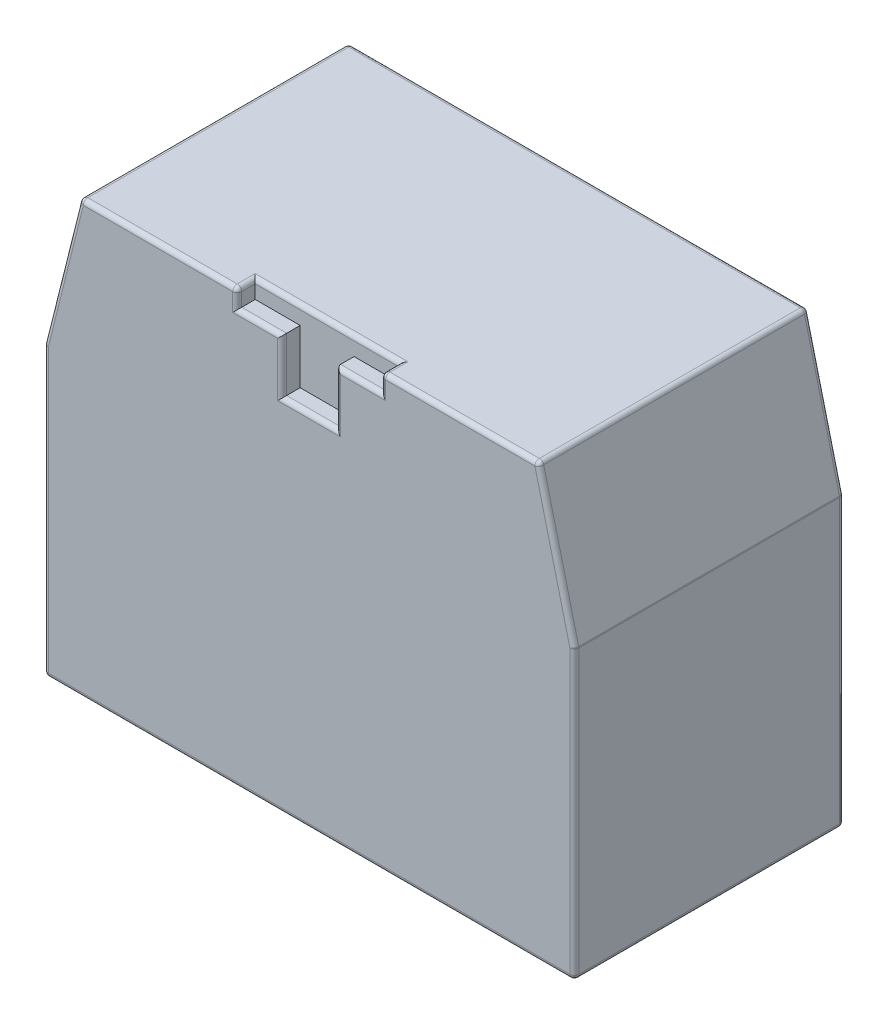
from build123d import *

# Parameters (mm, degrees)
BOSS_EXTRU_1_DEPTH      = 15
ENL_V_MAT_EXTRU_1_DEPTH = 1
ESQUISSE3_R             = 2.5
ENL_V_MAT_EXTRU_2_DEPTH = 2
CONG_1_R                = 0.25


with BuildPart() as part:
    # Esquisse1 → Boss.-Extru.1 (new body)
    with BuildSketch(Plane.XY):
        Polygon((0, 16), (2, 24), (27.5, 24), (29.5, 16), (29.5, 0), (0, 0), align=None)
    extrude(amount=BOSS_EXTRU_1_DEPTH)

    # Esquisse2 → Enlèv. mat.-Extru.1 (cut)
    with BuildSketch(Plane.XY.offset(15)):
        Polygon((16.25, 23), (18.75, 23), (18.75, 24), (10.75, 24), (10.75, 23), (13.25, 23), (13.25, 20), (16.25, 20), align=None)
    extrude(amount=-ENL_V_MAT_EXTRU_1_DEPTH, mode=Mode.SUBTRACT)

    # Esquisse3 → Enlèv. mat.-Extru.2 (cut)
    # profile 1 of 10: a face of its own
    with BuildSketch(Plane.XZ):
        with BuildLine():
            Line((8, 8), (8, 4))
            Line((8, 4), (2, 4))
            Line((2, 4), (2, 8))
            ThreePointArc((2, 8), (5, 11), (8, 8))
        make_face()
        with Locations(Location((5, 8, 0), (0, 0, 270))):
            Circle(ESQUISSE3_R, mode=Mode.SUBTRACT)
    # profile 2 of 10: a face of its own
    with BuildSketch(Plane.XZ):
        Polygon((5.451418397, 8.406224049), (6.574529481, 8.406224049), (6.574529481, 7.572948084), (5.451418397, 7.572948084), (5.451418397, 6.395492915), (4.654371821, 6.395492915), (4.654371821, 7.572948084), (3.404457873, 7.572948084), (3.404457873, 8.406224049), (4.654371821, 8.406224049), (4.654371821, 9.511220438), (5.451418397, 9.511220438), align=None)
    # profile 3 of 10: a face of its own
    with BuildSketch(Plane.XZ):
        with BuildLine():
            ThreePointArc((21.5, 8), (24.5, 11), (27.5, 8))
            Line((27.5, 8), (27.5, 4))
            Line((27.5, 4), (21.5, 4))
            Line((21.5, 4), (21.5, 8))
        make_face()
        with Locations(Location((24.5, 8, 0), (0, 0, 270))):
            Circle(ESQUISSE3_R, mode=Mode.SUBTRACT)
    # profile 4 of 10: a face of its own
    with BuildSketch(Plane.XZ):
        Polygon((24.048581603, 7.572948084), (22.925470519, 7.572948084), (22.925470519, 8.406224049), (24.048581603, 8.406224049), (24.048581603, 9.511220438), (24.845628179, 9.511220438), (24.845628179, 8.406224049), (26.095542127, 8.406224049), (26.095542127, 7.572948084), (24.845628179, 7.572948084), (24.845628179, 6.395492915), (24.048581603, 6.395492915), align=None)
    # profile 5 of 10: a face of its own
    with BuildSketch(Plane.XZ):
        with BuildLine():
            ThreePointArc((17.782508714, 11.769366031), (16.892304185, 13.902148971), (14.75, 14.76918989))
            Line((14.75, 14.76918989), (14.75, 14.269154659))
            ThreePointArc((14.75, 14.269154659), (16.538744492, 13.548589427), (17.282508714, 11.769366031))
            ThreePointArc((17.282508714, 11.769366031), (16.538744492, 9.990142635), (14.75, 9.269577403))
            Line((14.75, 9.269577403), (14.75, 8.769542172))
            ThreePointArc((14.75, 8.769542172), (16.892304185, 9.636583091), (17.782508714, 11.769366031))
        make_face()
    # profile 6 of 10: a face of its own
    with BuildSketch(Plane.XZ):
        with BuildLine():
            Line((14.75, 14.269154659), (14.75, 14.76918989))
            ThreePointArc((14.75, 14.76918989), (11.782508714, 11.769366031), (14.75, 8.769542172))
            Line((14.75, 8.769542172), (14.75, 9.269577403))
            ThreePointArc((14.75, 9.269577403), (12.282508714, 11.769366031), (14.75, 14.269154659))
        make_face()
    # profile 7 of 10: a face of its own
    with BuildSketch(Plane.XZ):
        with BuildLine():
            ThreePointArc((17.782508714, 11.769366031), (16.892304185, 13.902148971), (14.75, 14.76918989))
            Line((14.75, 14.76918989), (14.75, 14.269154659))
            ThreePointArc((14.75, 14.269154659), (16.538744492, 13.548589427), (17.282508714, 11.769366031))
            ThreePointArc((17.282508714, 11.769366031), (16.538744492, 9.990142635), (14.75, 9.269577403))
            Line((14.75, 9.269577403), (14.75, 8.769542172))
            ThreePointArc((14.75, 8.769542172), (16.892304185, 9.636583091), (17.782508714, 11.769366031))
        make_face()
    # profile 8 of 10: a face of its own
    with BuildSketch(Plane.XZ):
        with BuildLine():
            Line((14.75, 14.269154659), (14.75, 14.76918989))
            ThreePointArc((14.75, 14.76918989), (11.782508714, 11.769366031), (14.75, 8.769542172))
            Line((14.75, 8.769542172), (14.75, 9.269577403))
            ThreePointArc((14.75, 9.269577403), (12.282508714, 11.769366031), (14.75, 14.269154659))
        make_face()
    # profile 9 of 10: a face of its own
    with BuildSketch(Plane.XZ):
        Polygon((14.75, 10.164858946), (14.75, 13.280586469), (14.331090317, 13.280586469), (14.331090317, 12.17559008), (13.207979233, 12.17559008), (13.207979233, 11.342314115), (14.331090317, 11.342314115), (14.331090317, 10.164858946), align=None)
    # profile 10 of 10: a face of its own
    with BuildSketch(Plane.XZ):
        Polygon((15.128136892, 13.280586469), (14.75, 13.280586469), (14.75, 10.164858946), (15.128136892, 10.164858946), (15.128136892, 11.342314115), (16.378050841, 11.342314115), (16.378050841, 12.17559008), (15.128136892, 12.17559008), align=None)
    extrude(amount=-ENL_V_MAT_EXTRU_2_DEPTH, mode=Mode.SUBTRACT)

    # Congé1
    # the kernel refuses this fillet: 0.25 mm, written as the material it adds along each edge
    with BuildSketch(Plane(origin=(7.75, 1.75, 4.25), x_dir=(0, 1, 0), z_dir=(1, 0, 0))) as cong_1_piece_1_section:
        Polygon((0, 0), (CONG_1_R, 0), (CONG_1_R, -CONG_1_R), (0, -CONG_1_R), align=None)
    cong_1_piece_1 = extrude(amount=CONG_1_R, mode=Mode.PRIVATE)
    cong_1_piece_1 = cong_1_piece_1 - Plane(origin=(7.75, 1.75, 4.25), x_dir=(0, -0.7071067811865475, 0.7071067811865475), z_dir=(1, 0, 0)) * Sphere(CONG_1_R, mode=Mode.PRIVATE)
    add(cong_1_piece_1)
    with BuildSketch(Plane(origin=(2.25, 1.75, 4.25), x_dir=(-1, 0, 0), z_dir=(0, 1, 0))) as cong_1_piece_2_section:
        Polygon((0, 0), (CONG_1_R, 0), (CONG_1_R, -CONG_1_R), (0, -CONG_1_R), align=None)
    cong_1_piece_2 = extrude(amount=CONG_1_R, mode=Mode.PRIVATE)
    cong_1_piece_2 = cong_1_piece_2 - Plane(origin=(2.25, 1.75, 4.25), x_dir=(0.7071067811865475, 0, 0.7071067811865477), z_dir=(0, 1, 0)) * Sphere(CONG_1_R, mode=Mode.PRIVATE)
    add(cong_1_piece_2)
    with BuildSketch(Plane(origin=(27.25, 1.75, 4.25), x_dir=(0, 0, -1), z_dir=(0, 1, 0))) as cong_1_piece_3_section:
        Polygon((0, 0), (CONG_1_R, 0), (CONG_1_R, -CONG_1_R), (0, -CONG_1_R), align=None)
    cong_1_piece_3 = extrude(amount=CONG_1_R, mode=Mode.PRIVATE)
    cong_1_piece_3 = cong_1_piece_3 - Plane(origin=(27.25, 1.75, 4.25), x_dir=(-0.7071067811865475, 0, 0.7071067811865475), z_dir=(0, 1, 0)) * Sphere(CONG_1_R, mode=Mode.PRIVATE)
    add(cong_1_piece_3)
    with BuildSketch(Plane(origin=(21.75, 1.75, 4.25), x_dir=(0, 1, 0), z_dir=(-1, 0, 0))) as cong_1_piece_4_section:
        Polygon((0, 0), (CONG_1_R, 0), (CONG_1_R, CONG_1_R), (0, CONG_1_R), align=None)
    cong_1_piece_4 = extrude(amount=CONG_1_R, mode=Mode.PRIVATE)
    cong_1_piece_4 = cong_1_piece_4 - Plane(origin=(21.75, 1.75, 4.25), x_dir=(0, -0.7071067811865475, 0.7071067811865475), z_dir=(-1, 0, 0)) * Sphere(CONG_1_R, mode=Mode.PRIVATE)
    add(cong_1_piece_4)
    with BuildSketch(Plane(origin=(7.75, 2, 4), x_dir=(0, -1, 0), z_dir=(-1, 0, 0)), Plane(origin=(27.25, 2, 4), x_dir=(0, -1, 0), z_dir=(-1, 0, 0))) as cong_1_piece_5:
        with BuildLine():
            CenterArc((CONG_1_R, CONG_1_R), CONG_1_R, 180, 90)
            Line((0, CONG_1_R), (0, 0))
            Line((0, 0), (CONG_1_R, 0))
        make_face()
    extrude(amount=5.5)
    with BuildSketch(Plane(origin=(8, 0, 4), x_dir=(-1, 0, 0), z_dir=(0, 1, 0)), Plane(origin=(2, 0, 4), x_dir=(0, 0, 1), z_dir=(0, 1, 0)), Plane(origin=(27.5, 0, 4), x_dir=(-1, 0, 0), z_dir=(0, 1, 0)), Plane(origin=(21.5, 0, 4), x_dir=(0, 0, 1), z_dir=(0, 1, 0))) as cong_1_piece_6:
        with BuildLine():
            CenterArc((CONG_1_R, CONG_1_R), CONG_1_R, 180, 90)
            Line((0, CONG_1_R), (0, 0))
            Line((0, 0), (CONG_1_R, 0))
        make_face()
    extrude(amount=1.75)
    with BuildSketch(Plane(origin=(2, 2, 4.25), x_dir=(0, -1, 0), z_dir=(0, 0, 1)), Plane(origin=(8, 2, 8), x_dir=(0, -1, 0), z_dir=(0, 0, -1)), Plane(origin=(21.5, 2, 4.25), x_dir=(0, -1, 0), z_dir=(0, 0, 1)), Plane(origin=(27.5, 2, 8), x_dir=(0, -1, 0), z_dir=(0, 0, -1))) as cong_1_piece_7:
        with BuildLine():
            CenterArc((CONG_1_R, CONG_1_R), CONG_1_R, 180, 90)
            Line((0, CONG_1_R), (0, 0))
            Line((0, 0), (CONG_1_R, 0))
        make_face()
    extrude(amount=3.75)
    with BuildSketch(Plane(origin=(5, 2, 8), x_dir=(-1, 0, 0), z_dir=(0, 0, -1))) as cong_1_piece_8:
        with BuildLine():
            CenterArc((3 - CONG_1_R, -CONG_1_R), CONG_1_R, 0, 90)
            Line((3 - CONG_1_R, 0), (3, 0))
            Line((3, 0), (3, -CONG_1_R))
        make_face()
    revolve(axis=Axis((5, 2, 8), (0, 1, 0)), revolution_arc=180)
    with BuildSketch(Plane(origin=(24.5, 2, 8), x_dir=(-1, 0, 0), z_dir=(0, 0, -1))) as cong_1_piece_9:
        with BuildLine():
            CenterArc((3 - CONG_1_R, -CONG_1_R), CONG_1_R, 0, 90)
            Line((3 - CONG_1_R, 0), (3, 0))
            Line((3, 0), (3, -CONG_1_R))
        make_face()
    revolve(axis=Axis((24.5, 2, 8), (0, 1, 0)), revolution_arc=180)
    # the kernel refuses this fillet: 0.25 mm, written as the material it takes off along each edge
    with BuildSketch(Plane(origin=(29.25, 15.969223594, 14.75), x_dir=(0.9701425001453319, 0.2425356250363334, 0), z_dir=(0, 0, 1))) as cong_1_2_piece_1_section:
        Polygon((0, 0), (CONG_1_R, 0), (CONG_1_R, -CONG_1_R * 0.123105625618), (CONG_1_R * 0.970142500145, -CONG_1_R * 0.242535625036), align=None)
    cong_1_2_piece_1 = extrude(amount=CONG_1_R, mode=Mode.PRIVATE)
    cong_1_2_piece_1 = cong_1_2_piece_1 - Plane(origin=(29.25, 15.969223594, 14.75), x_dir=(-0.992507556682903, -0.12218326369570469, 0), z_dir=(0, 0, 1)) * Sphere(CONG_1_R, mode=Mode.PRIVATE)
    add(cong_1_2_piece_1, mode=Mode.SUBTRACT)
    with BuildSketch(Plane(origin=(29.25, 0.25, 14.75), x_dir=(0, 0, 1), z_dir=(1, 0, 0))) as cong_1_2_piece_2_section:
        Polygon((0, 0), (CONG_1_R, 0), (CONG_1_R, CONG_1_R), (0, CONG_1_R), align=None)
    cong_1_2_piece_2 = extrude(amount=CONG_1_R, mode=Mode.PRIVATE)
    cong_1_2_piece_2 = cong_1_2_piece_2 - Plane(origin=(29.25, 0.25, 14.75), x_dir=(0, 0.7071067811865475, -0.7071067811865475), z_dir=(1, 0, 0)) * Sphere(CONG_1_R, mode=Mode.PRIVATE)
    add(cong_1_2_piece_2, mode=Mode.SUBTRACT)
    with BuildSketch(Plane(origin=(0.25, 15.969223594, 0.25), x_dir=(-0.9701425001453319, 0.24253562503633297, 0), z_dir=(0, 0, -1))) as cong_1_2_piece_3_section:
        Polygon((0, 0), (CONG_1_R, 0), (CONG_1_R, -CONG_1_R * 0.123105625618), (CONG_1_R * 0.970142500145, -CONG_1_R * 0.242535625036), align=None)
    cong_1_2_piece_3 = extrude(amount=CONG_1_R, mode=Mode.PRIVATE)
    cong_1_2_piece_3 = cong_1_2_piece_3 - Plane(origin=(0.25, 15.969223594, 0.25), x_dir=(0.9925075566829031, -0.12218326369570448, 0), z_dir=(0, 0, -1)) * Sphere(CONG_1_R, mode=Mode.PRIVATE)
    add(cong_1_2_piece_3, mode=Mode.SUBTRACT)
    with BuildSketch(Plane(origin=(0.25, 15.969223594, 14.75), x_dir=(-0.9701425001453319, 0.24253562503633297, 0), z_dir=(0, 0, 1))) as cong_1_2_piece_4_section:
        Polygon((0, 0), (CONG_1_R, 0), (CONG_1_R, CONG_1_R * 0.123105625618), (CONG_1_R * 0.970142500145, CONG_1_R * 0.242535625036), align=None)
    cong_1_2_piece_4 = extrude(amount=CONG_1_R, mode=Mode.PRIVATE)
    cong_1_2_piece_4 = cong_1_2_piece_4 - Plane(origin=(0.25, 15.969223594, 14.75), x_dir=(0.9925075566829031, -0.12218326369570448, 0), z_dir=(0, 0, 1)) * Sphere(CONG_1_R, mode=Mode.PRIVATE)
    add(cong_1_2_piece_4, mode=Mode.SUBTRACT)
    with BuildSketch(Plane(origin=(2.195194102, 23.75, 0.25), x_dir=(-0.9701425001453319, 0.24253562503633297, 0), z_dir=(0, 0, -1))) as cong_1_2_piece_5_section:
        Polygon((0, 0), (CONG_1_R, 0), (CONG_1_R, CONG_1_R * 0.780776406404), (CONG_1_R * 0.242535625036, CONG_1_R * 0.970142500145), align=None)
    cong_1_2_piece_5 = extrude(amount=CONG_1_R, mode=Mode.PRIVATE)
    cong_1_2_piece_5 = cong_1_2_piece_5 - Plane(origin=(2.195194102, 23.75, 0.25), x_dir=(0.6154122094026356, -0.7882054380161092, 0), z_dir=(0, 0, -1)) * Sphere(CONG_1_R, mode=Mode.PRIVATE)
    add(cong_1_2_piece_5, mode=Mode.SUBTRACT)
    with BuildSketch(Plane(origin=(2.195194102, 23.75, 14.75), x_dir=(-0.9701425001453319, 0.24253562503633297, 0), z_dir=(0, 0, 1))) as cong_1_2_piece_6_section:
        Polygon((0, 0), (CONG_1_R, 0), (CONG_1_R, -CONG_1_R * 0.780776406404), (CONG_1_R * 0.242535625036, -CONG_1_R * 0.970142500145), align=None)
    cong_1_2_piece_6 = extrude(amount=CONG_1_R, mode=Mode.PRIVATE)
    cong_1_2_piece_6 = cong_1_2_piece_6 - Plane(origin=(2.195194102, 23.75, 14.75), x_dir=(0.6154122094026356, -0.7882054380161092, 0), z_dir=(0, 0, 1)) * Sphere(CONG_1_R, mode=Mode.PRIVATE)
    add(cong_1_2_piece_6, mode=Mode.SUBTRACT)
    with BuildSketch(Plane(origin=(27.304805898, 23.75, 0.25), x_dir=(0.9701425001453319, 0.2425356250363334, 0), z_dir=(0, 0, -1))) as cong_1_2_piece_7_section:
        Polygon((0, 0), (CONG_1_R, 0), (CONG_1_R, -CONG_1_R * 0.780776406404), (CONG_1_R * 0.242535625036, -CONG_1_R * 0.970142500145), align=None)
    cong_1_2_piece_7 = extrude(amount=CONG_1_R, mode=Mode.PRIVATE)
    cong_1_2_piece_7 = cong_1_2_piece_7 - Plane(origin=(27.304805898, 23.75, 0.25), x_dir=(-0.6154122094026354, -0.7882054380161092, 0), z_dir=(0, 0, -1)) * Sphere(CONG_1_R, mode=Mode.PRIVATE)
    add(cong_1_2_piece_7, mode=Mode.SUBTRACT)
    with BuildSketch(Plane(origin=(27.304805898, 23.75, 14.75), x_dir=(0.9701425001453319, 0.2425356250363334, 0), z_dir=(0, 0, 1))) as cong_1_2_piece_8_section:
        Polygon((0, 0), (CONG_1_R, 0), (CONG_1_R, CONG_1_R * 0.780776406404), (CONG_1_R * 0.242535625036, CONG_1_R * 0.970142500145), align=None)
    cong_1_2_piece_8 = extrude(amount=CONG_1_R, mode=Mode.PRIVATE)
    cong_1_2_piece_8 = cong_1_2_piece_8 - Plane(origin=(27.304805898, 23.75, 14.75), x_dir=(-0.6154122094026354, -0.7882054380161092, 0), z_dir=(0, 0, 1)) * Sphere(CONG_1_R, mode=Mode.PRIVATE)
    add(cong_1_2_piece_8, mode=Mode.SUBTRACT)
    with BuildSketch(Plane(origin=(29.25, 15.969223594, 0.25), x_dir=(0.9701425001453319, 0.2425356250363334, 0), z_dir=(0, 0, -1))) as cong_1_2_piece_9_section:
        Polygon((0, 0), (CONG_1_R, 0), (CONG_1_R, CONG_1_R * 0.123105625618), (CONG_1_R * 0.970142500145, CONG_1_R * 0.242535625036), align=None)
    cong_1_2_piece_9 = extrude(amount=CONG_1_R, mode=Mode.PRIVATE)
    cong_1_2_piece_9 = cong_1_2_piece_9 - Plane(origin=(29.25, 15.969223594, 0.25), x_dir=(-0.992507556682903, -0.12218326369570469, 0), z_dir=(0, 0, -1)) * Sphere(CONG_1_R, mode=Mode.PRIVATE)
    add(cong_1_2_piece_9, mode=Mode.SUBTRACT)
    with BuildSketch(Plane(origin=(29.25, 0.25, 0.25), x_dir=(0, 0, -1), z_dir=(1, 0, 0))) as cong_1_2_piece_10_section:
        Polygon((0, 0), (CONG_1_R, 0), (CONG_1_R, -CONG_1_R), (0, -CONG_1_R), align=None)
    cong_1_2_piece_10 = extrude(amount=CONG_1_R, mode=Mode.PRIVATE)
    cong_1_2_piece_10 = cong_1_2_piece_10 - Plane(origin=(29.25, 0.25, 0.25), x_dir=(0, 0.7071067811865475, 0.7071067811865475), z_dir=(1, 0, 0)) * Sphere(CONG_1_R, mode=Mode.PRIVATE)
    add(cong_1_2_piece_10, mode=Mode.SUBTRACT)
    with BuildSketch(Plane(origin=(0.25, 0.25, 0.25), x_dir=(0, 0, -1), z_dir=(-1, 0, 0))) as cong_1_2_piece_11_section:
        Polygon((0, 0), (CONG_1_R, 0), (CONG_1_R, CONG_1_R), (0, CONG_1_R), align=None)
    cong_1_2_piece_11 = extrude(amount=CONG_1_R, mode=Mode.PRIVATE)
    cong_1_2_piece_11 = cong_1_2_piece_11 - Plane(origin=(0.25, 0.25, 0.25), x_dir=(0, 0.7071067811865475, 0.7071067811865475), z_dir=(-1, 0, 0)) * Sphere(CONG_1_R, mode=Mode.PRIVATE)
    add(cong_1_2_piece_11, mode=Mode.SUBTRACT)
    with BuildSketch(Plane(origin=(0.25, 0.25, 14.75), x_dir=(0, 0, 1), z_dir=(-1, 0, 0))) as cong_1_2_piece_12_section:
        Polygon((0, 0), (CONG_1_R, 0), (CONG_1_R, -CONG_1_R), (0, -CONG_1_R), align=None)
    cong_1_2_piece_12 = extrude(amount=CONG_1_R, mode=Mode.PRIVATE)
    cong_1_2_piece_12 = cong_1_2_piece_12 - Plane(origin=(0.25, 0.25, 14.75), x_dir=(0, 0.7071067811865475, -0.7071067811865475), z_dir=(-1, 0, 0)) * Sphere(CONG_1_R, mode=Mode.PRIVATE)
    add(cong_1_2_piece_12, mode=Mode.SUBTRACT)
    with BuildSketch(Plane(origin=(19, 23.75, 14.75), x_dir=(0, 0, 1), z_dir=(0, 1, 0))) as cong_1_2_piece_13_section:
        Polygon((0, 0), (CONG_1_R, 0), (CONG_1_R, -CONG_1_R), (0, -CONG_1_R), align=None)
    cong_1_2_piece_13 = extrude(amount=CONG_1_R, mode=Mode.PRIVATE)
    cong_1_2_piece_13 = cong_1_2_piece_13 - Plane(origin=(19, 23.75, 14.75), x_dir=(0.7071067811865475, 0, -0.7071067811865475), z_dir=(0, 1, 0)) * Sphere(CONG_1_R, mode=Mode.PRIVATE)
    add(cong_1_2_piece_13, mode=Mode.SUBTRACT)
    with BuildSketch(Plane(origin=(10.5, 23.75, 14.75), x_dir=(0, 1, 0), z_dir=(1, 0, 0))) as cong_1_2_piece_14_section:
        Polygon((0, 0), (CONG_1_R, 0), (CONG_1_R, CONG_1_R), (0, CONG_1_R), align=None)
    cong_1_2_piece_14 = extrude(amount=CONG_1_R, mode=Mode.PRIVATE)
    cong_1_2_piece_14 = cong_1_2_piece_14 - Plane(origin=(10.5, 23.75, 14.75), x_dir=(0, -0.7071067811865475, -0.7071067811865475), z_dir=(1, 0, 0)) * Sphere(CONG_1_R, mode=Mode.PRIVATE)
    add(cong_1_2_piece_14, mode=Mode.SUBTRACT)
    with BuildSketch(Plane(origin=(29.5, 15.969223594, 15), x_dir=(-1, 0, 0), z_dir=(0, -1, 0)), Plane(origin=(0, 0.25, 0), x_dir=(0, 0, 1), z_dir=(0, 1, 0))) as cong_1_2_piece_15:
        with BuildLine():
            CenterArc((CONG_1_R, CONG_1_R), CONG_1_R, 180, 90)
            Line((0, CONG_1_R), (0, 0))
            Line((0, 0), (CONG_1_R, 0))
        make_face()
    extrude(amount=15.719223594, mode=Mode.SUBTRACT)
    with BuildSketch(Plane(origin=(0, 16, 0.25), x_dir=(0.24253562503633636, 0.970142500145331, 0), z_dir=(0, 0, 1))) as cong_1_2_piece_16:
        with BuildLine():
            CenterArc((CONG_1_R * 0.123105625618, -CONG_1_R), CONG_1_R, 90, 14.036243468)
            Line((-CONG_1_R * 0.119429999419, -CONG_1_R * 0.0298574998547), (0, 0))
            Line((0, 0), (CONG_1_R * 0.123105625618, 0))
        make_face()
    extrude(amount=14.5, mode=Mode.SUBTRACT)
    with BuildSketch(Plane(origin=(2, 24, 0.25), x_dir=(-0.24253562503633083, -0.9701425001453324, 0), z_dir=(0, 0, 1)), Plane(origin=(27.5, 24, 0.25), x_dir=(-1, 0, 0), z_dir=(0, 0, 1))) as cong_1_2_piece_17:
        with BuildLine():
            CenterArc((CONG_1_R * 0.780776406404, CONG_1_R), CONG_1_R, 194.036243468, 75.963756532)
            Line((-CONG_1_R * 0.189366093741, CONG_1_R * 0.757464374964), (0, 0))
            Line((0, 0), (CONG_1_R * 0.780776406404, 0))
        make_face()
    extrude(amount=14.5, mode=Mode.SUBTRACT)
    with BuildSketch(Plane(origin=(29.5, 16, 0.25), x_dir=(-0.24253562503636014, 0.9701425001453251, 0), z_dir=(0, 0, 1))) as cong_1_2_piece_18:
        with BuildLine():
            CenterArc((CONG_1_R * 0.123105625618, CONG_1_R), CONG_1_R, 255.963756532, 14.036243468)
            Line((-CONG_1_R * 0.119429999419, CONG_1_R * 0.0298574998547), (0, 0))
            Line((0, 0), (CONG_1_R * 0.123105625618, 0))
        make_face()
    extrude(amount=14.5, mode=Mode.SUBTRACT)
    with BuildSketch(Plane(origin=(29.5, 0, 0.25), x_dir=(-1, 0, 0), z_dir=(0, 0, 1)), Plane(origin=(0, 0, 0.25), x_dir=(0, 1, 0), z_dir=(0, 0, 1))) as cong_1_2_piece_19:
        with BuildLine():
            CenterArc((CONG_1_R, -CONG_1_R), CONG_1_R, 90, 90)
            Line((0, -CONG_1_R), (0, 0))
            Line((0, 0), (CONG_1_R, 0))
        make_face()
    extrude(amount=14.5, mode=Mode.SUBTRACT)
    with BuildSketch(Plane(origin=(27.547341523, 23.810633906, 15), x_dir=(-0.9701425001453319, -0.2425356250363334, 0), z_dir=(0.2425356250363334, -0.9701425001453319, 0)), Plane(origin=(0.007464375, 16.0298575, 0), x_dir=(0, 0, 1), z_dir=(0.24253562503633297, 0.9701425001453319, 0))) as cong_1_2_piece_20:
        with BuildLine():
            CenterArc((CONG_1_R, CONG_1_R), CONG_1_R, 180, 90)
            Line((0, CONG_1_R), (0, 0))
            Line((0, 0), (CONG_1_R, 0))
        make_face()
    extrude(amount=8.020240743, mode=Mode.SUBTRACT)
    with BuildSketch(Plane(origin=(14.782508714, 0, 11.769366031), x_dir=(-0.01300348552603837, 0, -0.9999154511078295), z_dir=(0.9999154511078295, 0, -0.01300348552603837))) as cong_1_2_piece_21:
        with BuildLine():
            CenterArc((2.5 - CONG_1_R, CONG_1_R), CONG_1_R, 270, 90)
            Line((2.5 - CONG_1_R, 0), (2.5, 0))
            Line((2.5, 0), (2.5, CONG_1_R))
        make_face()
    revolve(axis=Axis((14.782508714, 0, 11.769366031), (0, 1, 0)), mode=Mode.SUBTRACT)
    with BuildSketch(Plane(origin=(14.782508714, 0, 11.769366031), x_dir=(-0.010836237938338657, 0, 0.9999412862500198), z_dir=(-0.9999412862500198, 0, -0.010836237938338657))) as cong_1_2_piece_22:
        with BuildLine():
            CenterArc((3 + CONG_1_R, CONG_1_R), CONG_1_R, 180, 90)
            Line((3, CONG_1_R), (3, 0))
            Line((3, 0), (3 + CONG_1_R, 0))
        make_face()
    revolve(axis=Axis((14.782508714, 0, 11.769366031), (0, 1, 0)), mode=Mode.SUBTRACT)
    with BuildSketch(Plane(origin=(19, 24, 15), x_dir=(0, 0, -1), z_dir=(1, 0, 0)), Plane(origin=(2.195194102, 24, 15), x_dir=(0, 0, -1), z_dir=(1, 0, 0))) as cong_1_2_piece_23:
        with BuildLine():
            CenterArc((CONG_1_R, -CONG_1_R), CONG_1_R, 90, 90)
            Line((0, -CONG_1_R), (0, 0))
            Line((0, 0), (CONG_1_R, 0))
        make_face()
    extrude(amount=8.304805898, mode=Mode.SUBTRACT)
    with BuildSketch(Plane(origin=(0.007464375, 16.0298575, 15), x_dir=(0, 0, -1), z_dir=(0.24253562503633297, 0.9701425001453319, 0)), Plane(origin=(27.547341523, 23.810633906, 0), x_dir=(-0.9701425001453319, -0.2425356250363334, 0), z_dir=(0.2425356250363334, -0.9701425001453319, 0))) as cong_1_2_piece_24:
        with BuildLine():
            CenterArc((CONG_1_R, -CONG_1_R), CONG_1_R, 90, 90)
            Line((0, -CONG_1_R), (0, 0))
            Line((0, 0), (CONG_1_R, 0))
        make_face()
    extrude(amount=8.020240743, mode=Mode.SUBTRACT)
    with BuildSketch(Plane(origin=(18.75, 24, 14), x_dir=(0, 0, -1), z_dir=(-1, 0, 0))) as cong_1_2_piece_25:
        with BuildLine():
            CenterArc((CONG_1_R, CONG_1_R), CONG_1_R, 180, 90)
            Line((0, CONG_1_R), (0, 0))
            Line((0, 0), (CONG_1_R, 0))
        make_face()
    extrude(amount=8, mode=Mode.SUBTRACT)
    with BuildSketch(Plane(origin=(10.75, 24, 14.75), x_dir=(-1, 0, 0), z_dir=(0, 0, -1))) as cong_1_2_piece_26:
        with BuildLine():
            CenterArc((CONG_1_R, -CONG_1_R), CONG_1_R, 90, 90)
            Line((0, -CONG_1_R), (0, 0))
            Line((0, 0), (CONG_1_R, 0))
        make_face()
    extrude(amount=0.75, mode=Mode.SUBTRACT)
    with BuildSketch(Plane(origin=(18.75, 24, 14.75), x_dir=(1, 0, 0), z_dir=(0, 0, -1)), Plane(origin=(10.75, 23.75, 15), x_dir=(-1, 0, 0), z_dir=(0, -1, 0)), Plane(origin=(18.75, 23, 15), x_dir=(1, 0, 0), z_dir=(0, 1, 0))) as cong_1_2_piece_27:
        with BuildLine():
            CenterArc((CONG_1_R, CONG_1_R), CONG_1_R, 180, 90)
            Line((0, CONG_1_R), (0, 0))
            Line((0, 0), (CONG_1_R, 0))
        make_face()
    extrude(amount=0.75, mode=Mode.SUBTRACT)
    with BuildSketch(Plane(origin=(10.75, 23, 15), x_dir=(0, -1, 0), z_dir=(1, 0, 0)), Plane(origin=(15.625, 23, 15), x_dir=(0, -1, 0), z_dir=(1, 0, 0))) as cong_1_2_piece_28:
        with BuildLine():
            CenterArc((CONG_1_R, CONG_1_R), CONG_1_R, 180, 90)
            Line((0, CONG_1_R), (0, 0))
            Line((0, 0), (CONG_1_R, 0))
        make_face()
    extrude(amount=3.125, mode=Mode.SUBTRACT)
    with BuildSketch(Plane(origin=(13.25, 23.625, 15), x_dir=(-1, 0, 0), z_dir=(0, -1, 0)), Plane(origin=(16.25, 20, 15), x_dir=(1, 0, 0), z_dir=(0, 1, 0))) as cong_1_2_piece_29:
        with BuildLine():
            CenterArc((CONG_1_R, CONG_1_R), CONG_1_R, 180, 90)
            Line((0, CONG_1_R), (0, 0))
            Line((0, 0), (CONG_1_R, 0))
        make_face()
    extrude(amount=3.625, mode=Mode.SUBTRACT)
    with BuildSketch(Plane(origin=(13.25, 20, 15), x_dir=(0, -1, 0), z_dir=(1, 0, 0))) as cong_1_2_piece_30:
        with BuildLine():
            CenterArc((CONG_1_R, CONG_1_R), CONG_1_R, 180, 90)
            Line((0, CONG_1_R), (0, 0))
            Line((0, 0), (CONG_1_R, 0))
        make_face()
    extrude(amount=3, mode=Mode.SUBTRACT)
    with BuildSketch(Plane(origin=(0, 0.25, 15), x_dir=(0, 0, -1), z_dir=(0, 1, 0)), Plane(origin=(29.5, 15.969223594, 0), x_dir=(-1, 0, 0), z_dir=(0, -1, 0))) as cong_1_2_piece_31:
        with BuildLine():
            CenterArc((CONG_1_R, -CONG_1_R), CONG_1_R, 90, 90)
            Line((0, -CONG_1_R), (0, 0))
            Line((0, 0), (CONG_1_R, 0))
        make_face()
    extrude(amount=15.719223594, mode=Mode.SUBTRACT)
    with BuildSketch(Plane(origin=(5, 0, 8), x_dir=(0, 0, -1), z_dir=(-1, 0, 0))) as cong_1_2_piece_32:
        with BuildLine():
            CenterArc((2.5 - CONG_1_R, -CONG_1_R), CONG_1_R, 0, 90)
            Line((2.5 - CONG_1_R, 0), (2.5, 0))
            Line((2.5, 0), (2.5, -CONG_1_R))
        make_face()
    revolve(axis=Axis((5, 0, 8), (0, -1, 0)), mode=Mode.SUBTRACT)
    with BuildSketch(Plane(origin=(2.195194102, 24, 0), x_dir=(0, 0, 1), z_dir=(1, 0, 0))) as cong_1_2_piece_33:
        with BuildLine():
            CenterArc((CONG_1_R, CONG_1_R), CONG_1_R, 180, 90)
            Line((0, CONG_1_R), (0, 0))
            Line((0, 0), (CONG_1_R, 0))
        make_face()
    extrude(amount=25.109611797, mode=Mode.SUBTRACT)
    with BuildSketch(Plane(origin=(29.25, 0, 15), x_dir=(0, 1, 0), z_dir=(-1, 0, 0))) as cong_1_2_piece_34:
        with BuildLine():
            CenterArc((CONG_1_R, CONG_1_R), CONG_1_R, 180, 90)
            Line((0, CONG_1_R), (0, 0))
            Line((0, 0), (CONG_1_R, 0))
        make_face()
    extrude(amount=29, mode=Mode.SUBTRACT)
    with BuildSketch(Plane(origin=(29.25, 0, 0), x_dir=(0, 1, 0), z_dir=(-1, 0, 0))) as cong_1_2_piece_35:
        with BuildLine():
            CenterArc((CONG_1_R, -CONG_1_R), CONG_1_R, 90, 90)
            Line((0, -CONG_1_R), (0, 0))
            Line((0, 0), (CONG_1_R, 0))
        make_face()
    extrude(amount=29, mode=Mode.SUBTRACT)
    with BuildSketch(Plane(origin=(24.5, 0, 8), x_dir=(0, 0, -1), z_dir=(-1, 0, 0))) as cong_1_2_piece_36:
        with BuildLine():
            CenterArc((2.5 - CONG_1_R, -CONG_1_R), CONG_1_R, 0, 90)
            Line((2.5 - CONG_1_R, 0), (2.5, 0))
            Line((2.5, 0), (2.5, -CONG_1_R))
        make_face()
    revolve(axis=Axis((24.5, 0, 8), (0, -1, 0)), mode=Mode.SUBTRACT)
    with BuildSketch(Plane(origin=(18.75, 24, 14.75), x_dir=(1, 0, 0), z_dir=(0, 0, -1))) as cong_1_2_piece_37a_section:
        with BuildLine():
            CenterArc((CONG_1_R, CONG_1_R), CONG_1_R, 180, 90)
            Line((0, CONG_1_R), (0, 0))
            Line((0, 0), (CONG_1_R, 0))
        make_face()
    cong_1_2_piece_37a = extrude(amount=1.375, mode=Mode.PRIVATE)
    cong_1_2_piece_37a = split(cong_1_2_piece_37a, bisect_by=Plane(origin=(18.806598779, 23.943401221, 14), z_dir=(0, 0, -1)), keep=Keep.TOP, mode=Mode.PRIVATE)
    with BuildSketch(Plane(origin=(19.375, 24, 14), x_dir=(0, 0, -1), z_dir=(-1, 0, 0))) as cong_1_2_piece_37b_section:
        with BuildLine():
            CenterArc((CONG_1_R, CONG_1_R), CONG_1_R, 180, 90)
            Line((0, CONG_1_R), (0, 0))
            Line((0, 0), (CONG_1_R, 0))
        make_face()
    cong_1_2_piece_37b = extrude(amount=8.625, mode=Mode.PRIVATE)
    cong_1_2_piece_37b = split(cong_1_2_piece_37b, bisect_by=Plane(origin=(18.75, 23.943401221, 13.943401221), z_dir=(1, 0, 0)), keep=Keep.TOP, mode=Mode.PRIVATE)
    cong_1_2_piece_37 = cong_1_2_piece_37a & cong_1_2_piece_37b
    add(cong_1_2_piece_37, mode=Mode.SUBTRACT)
    with BuildSketch(Plane(origin=(18.75, 24, 14), x_dir=(0, 0, -1), z_dir=(-1, 0, 0))) as cong_1_2_piece_38a_section:
        with BuildLine():
            CenterArc((CONG_1_R, CONG_1_R), CONG_1_R, 180, 90)
            Line((0, CONG_1_R), (0, 0))
            Line((0, 0), (CONG_1_R, 0))
        make_face()
    cong_1_2_piece_38a = extrude(amount=8.625, mode=Mode.PRIVATE)
    cong_1_2_piece_38a = split(cong_1_2_piece_38a, bisect_by=Plane(origin=(10.75, 23.943401221, 13.943401221), z_dir=(-1, 0, 0)), keep=Keep.TOP, mode=Mode.PRIVATE)
    with BuildSketch(Plane(origin=(10.75, 24, 14.75), x_dir=(-1, 0, 0), z_dir=(0, 0, -1))) as cong_1_2_piece_38b_section:
        with BuildLine():
            CenterArc((CONG_1_R, -CONG_1_R), CONG_1_R, 90, 90)
            Line((0, -CONG_1_R), (0, 0))
            Line((0, 0), (CONG_1_R, 0))
        make_face()
    cong_1_2_piece_38b = extrude(amount=1.375, mode=Mode.PRIVATE)
    cong_1_2_piece_38b = split(cong_1_2_piece_38b, bisect_by=Plane(origin=(10.693401221, 23.943401221, 14), z_dir=(0, 0, -1)), keep=Keep.TOP, mode=Mode.PRIVATE)
    cong_1_2_piece_38 = cong_1_2_piece_38a & cong_1_2_piece_38b
    add(cong_1_2_piece_38, mode=Mode.SUBTRACT)
    with BuildSketch(Plane(origin=(10.125, 23, 15), x_dir=(0, -1, 0), z_dir=(1, 0, 0))) as cong_1_2_piece_39a_section:
        with BuildLine():
            CenterArc((CONG_1_R, CONG_1_R), CONG_1_R, 180, 90)
            Line((0, CONG_1_R), (0, 0))
            Line((0, 0), (CONG_1_R, 0))
        make_face()
    cong_1_2_piece_39a = extrude(amount=3.75, mode=Mode.PRIVATE)
    cong_1_2_piece_39a = split(cong_1_2_piece_39a, bisect_by=Plane(origin=(10.75, 22.943401221, 14.943401221), z_dir=(-1, 0, 0)), keep=Keep.TOP, mode=Mode.PRIVATE)
    with BuildSketch(Plane(origin=(10.75, 23.75, 15), x_dir=(-1, 0, 0), z_dir=(0, -1, 0))) as cong_1_2_piece_39b_section:
        with BuildLine():
            CenterArc((CONG_1_R, CONG_1_R), CONG_1_R, 180, 90)
            Line((0, CONG_1_R), (0, 0))
            Line((0, 0), (CONG_1_R, 0))
        make_face()
    cong_1_2_piece_39b = extrude(amount=1.375, mode=Mode.PRIVATE)
    cong_1_2_piece_39b = split(cong_1_2_piece_39b, bisect_by=Plane(origin=(10.693401221, 23, 14.943401221), z_dir=(0, -1, 0)), keep=Keep.TOP, mode=Mode.PRIVATE)
    cong_1_2_piece_39 = cong_1_2_piece_39a & cong_1_2_piece_39b
    add(cong_1_2_piece_39, mode=Mode.SUBTRACT)
    with BuildSketch(Plane(origin=(12.625, 20, 15), x_dir=(0, -1, 0), z_dir=(1, 0, 0))) as cong_1_2_piece_40a_section:
        with BuildLine():
            CenterArc((CONG_1_R, CONG_1_R), CONG_1_R, 180, 90)
            Line((0, CONG_1_R), (0, 0))
            Line((0, 0), (CONG_1_R, 0))
        make_face()
    cong_1_2_piece_40a = extrude(amount=3.625, mode=Mode.PRIVATE)
    cong_1_2_piece_40a = split(cong_1_2_piece_40a, bisect_by=Plane(origin=(13.25, 19.943401221, 14.943401221), z_dir=(-1, 0, 0)), keep=Keep.TOP, mode=Mode.PRIVATE)
    with BuildSketch(Plane(origin=(13.25, 23.625, 15), x_dir=(-1, 0, 0), z_dir=(0, -1, 0))) as cong_1_2_piece_40b_section:
        with BuildLine():
            CenterArc((CONG_1_R, CONG_1_R), CONG_1_R, 180, 90)
            Line((0, CONG_1_R), (0, 0))
            Line((0, 0), (CONG_1_R, 0))
        make_face()
    cong_1_2_piece_40b = extrude(amount=4.25, mode=Mode.PRIVATE)
    cong_1_2_piece_40b = split(cong_1_2_piece_40b, bisect_by=Plane(origin=(13.193401221, 20, 14.943401221), z_dir=(0, -1, 0)), keep=Keep.TOP, mode=Mode.PRIVATE)
    cong_1_2_piece_40 = cong_1_2_piece_40a & cong_1_2_piece_40b
    add(cong_1_2_piece_40, mode=Mode.SUBTRACT)
    with BuildSketch(Plane(origin=(16.25, 19.375, 15), x_dir=(1, 0, 0), z_dir=(0, 1, 0))) as cong_1_2_piece_41a_section:
        with BuildLine():
            CenterArc((CONG_1_R, CONG_1_R), CONG_1_R, 180, 90)
            Line((0, CONG_1_R), (0, 0))
            Line((0, 0), (CONG_1_R, 0))
        make_face()
    cong_1_2_piece_41a = extrude(amount=4.25, mode=Mode.PRIVATE)
    cong_1_2_piece_41a = split(cong_1_2_piece_41a, bisect_by=Plane(origin=(16.306598779, 20, 14.943401221), z_dir=(0, -1, 0)), keep=Keep.TOP, mode=Mode.PRIVATE)
    with BuildSketch(Plane(origin=(13.25, 20, 15), x_dir=(0, -1, 0), z_dir=(1, 0, 0))) as cong_1_2_piece_41b_section:
        with BuildLine():
            CenterArc((CONG_1_R, CONG_1_R), CONG_1_R, 180, 90)
            Line((0, CONG_1_R), (0, 0))
            Line((0, 0), (CONG_1_R, 0))
        make_face()
    cong_1_2_piece_41b = extrude(amount=3.625, mode=Mode.PRIVATE)
    cong_1_2_piece_41b = split(cong_1_2_piece_41b, bisect_by=Plane(origin=(16.25, 19.943401221, 14.943401221), z_dir=(1, 0, 0)), keep=Keep.TOP, mode=Mode.PRIVATE)
    cong_1_2_piece_41 = cong_1_2_piece_41a & cong_1_2_piece_41b
    add(cong_1_2_piece_41, mode=Mode.SUBTRACT)
    with BuildSketch(Plane(origin=(18.75, 22.375, 15), x_dir=(1, 0, 0), z_dir=(0, 1, 0))) as cong_1_2_piece_42a_section:
        with BuildLine():
            CenterArc((CONG_1_R, CONG_1_R), CONG_1_R, 180, 90)
            Line((0, CONG_1_R), (0, 0))
            Line((0, 0), (CONG_1_R, 0))
        make_face()
    cong_1_2_piece_42a = extrude(amount=1.375, mode=Mode.PRIVATE)
    cong_1_2_piece_42a = split(cong_1_2_piece_42a, bisect_by=Plane(origin=(18.806598779, 23, 14.943401221), z_dir=(0, -1, 0)), keep=Keep.TOP, mode=Mode.PRIVATE)
    with BuildSketch(Plane(origin=(15.625, 23, 15), x_dir=(0, -1, 0), z_dir=(1, 0, 0))) as cong_1_2_piece_42b_section:
        with BuildLine():
            CenterArc((CONG_1_R, CONG_1_R), CONG_1_R, 180, 90)
            Line((0, CONG_1_R), (0, 0))
            Line((0, 0), (CONG_1_R, 0))
        make_face()
    cong_1_2_piece_42b = extrude(amount=3.75, mode=Mode.PRIVATE)
    cong_1_2_piece_42b = split(cong_1_2_piece_42b, bisect_by=Plane(origin=(18.75, 22.943401221, 14.943401221), z_dir=(1, 0, 0)), keep=Keep.TOP, mode=Mode.PRIVATE)
    cong_1_2_piece_42 = cong_1_2_piece_42a & cong_1_2_piece_42b
    add(cong_1_2_piece_42, mode=Mode.SUBTRACT)
    # the kernel refuses this fillet: 0.25 mm, written as the material it takes off along each edge
    with BuildSketch(Plane(origin=(8, 0, 8), x_dir=(1, 0, 0), z_dir=(0, 0, -1)), Plane(origin=(2, 0, 4.25), x_dir=(-1, 0, 0), z_dir=(0, 0, 1)), Plane(origin=(27.5, 0, 8), x_dir=(1, 0, 0), z_dir=(0, 0, -1)), Plane(origin=(21.5, 0, 4.25), x_dir=(-1, 0, 0), z_dir=(0, 0, 1))) as cong_1_3_piece_1:
        with BuildLine():
            CenterArc((CONG_1_R, -CONG_1_R), CONG_1_R, 90, 90)
            Line((0, -CONG_1_R), (0, 0))
            Line((0, 0), (CONG_1_R, 0))
        make_face()
    extrude(amount=3.75, mode=Mode.SUBTRACT)
    with BuildSketch(Plane(origin=(5, 0, 8), x_dir=(-1, 0, 0), z_dir=(0, 0, -1))) as cong_1_3_piece_2:
        with BuildLine():
            CenterArc((3 + CONG_1_R, CONG_1_R), CONG_1_R, 180, 90)
            Line((3, CONG_1_R), (3, 0))
            Line((3, 0), (3 + CONG_1_R, 0))
        make_face()
    revolve(axis=Axis((5, 0, 8), (0, 1, 0)), revolution_arc=180, mode=Mode.SUBTRACT)
    with BuildSketch(Plane(origin=(7.75, 0, 4), x_dir=(0, 0, -1), z_dir=(-1, 0, 0)), Plane(origin=(27.25, 0, 4), x_dir=(0, 0, -1), z_dir=(-1, 0, 0))) as cong_1_3_piece_3:
        with BuildLine():
            CenterArc((CONG_1_R, -CONG_1_R), CONG_1_R, 90, 90)
            Line((0, -CONG_1_R), (0, 0))
            Line((0, 0), (CONG_1_R, 0))
        make_face()
    extrude(amount=5.5, mode=Mode.SUBTRACT)
    with BuildSketch(Plane(origin=(24.5, 0, 8), x_dir=(-1, 0, 0), z_dir=(0, 0, -1))) as cong_1_3_piece_4:
        with BuildLine():
            CenterArc((3 + CONG_1_R, CONG_1_R), CONG_1_R, 180, 90)
            Line((3, CONG_1_R), (3, 0))
            Line((3, 0), (3 + CONG_1_R, 0))
        make_face()
    revolve(axis=Axis((24.5, 0, 8), (0, 1, 0)), revolution_arc=180, mode=Mode.SUBTRACT)
    with BuildSketch(Plane(origin=(21.75, 0, 4.25), x_dir=(-1, 0, 0), z_dir=(0, 0, 1))) as cong_1_3_piece_5:
        with BuildLine():
            CenterArc((0.25 + CONG_1_R, -CONG_1_R), CONG_1_R, 90, 90)
            Line((0.25, -CONG_1_R), (0.25, 0))
            Line((0.25, 0), (0.25 + CONG_1_R, 0))
        make_face()
    revolve(axis=Axis((21.75, 0, 4.25), (0, -1, 0)), revolution_arc=90, mode=Mode.SUBTRACT)
    with BuildSketch(Plane(origin=(27.25, 0, 4.25), x_dir=(0, 0, -1), z_dir=(-1, 0, 0))) as cong_1_3_piece_6:
        with BuildLine():
            CenterArc((0.25 + CONG_1_R, -CONG_1_R), CONG_1_R, 90, 90)
            Line((0.25, -CONG_1_R), (0.25, 0))
            Line((0.25, 0), (0.25 + CONG_1_R, 0))
        make_face()
    revolve(axis=Axis((27.25, 0, 4.25), (0, -1, 0)), revolution_arc=90, mode=Mode.SUBTRACT)
    with BuildSketch(Plane(origin=(7.75, 0, 4.25), x_dir=(0, 0, -1), z_dir=(-1, 0, 0))) as cong_1_3_piece_7:
        with BuildLine():
            CenterArc((0.25 + CONG_1_R, -CONG_1_R), CONG_1_R, 90, 90)
            Line((0.25, -CONG_1_R), (0.25, 0))
            Line((0.25, 0), (0.25 + CONG_1_R, 0))
        make_face()
    revolve(axis=Axis((7.75, 0, 4.25), (0, -1, 0)), revolution_arc=90, mode=Mode.SUBTRACT)
    with BuildSketch(Plane(origin=(2.25, 0, 4.25), x_dir=(-1, 0, 0), z_dir=(0, 0, 1))) as cong_1_3_piece_8:
        with BuildLine():
            CenterArc((0.25 + CONG_1_R, -CONG_1_R), CONG_1_R, 90, 90)
            Line((0.25, -CONG_1_R), (0.25, 0))
            Line((0.25, 0), (0.25 + CONG_1_R, 0))
        make_face()
    revolve(axis=Axis((2.25, 0, 4.25), (0, -1, 0)), revolution_arc=90, mode=Mode.SUBTRACT)


solid = part.part
